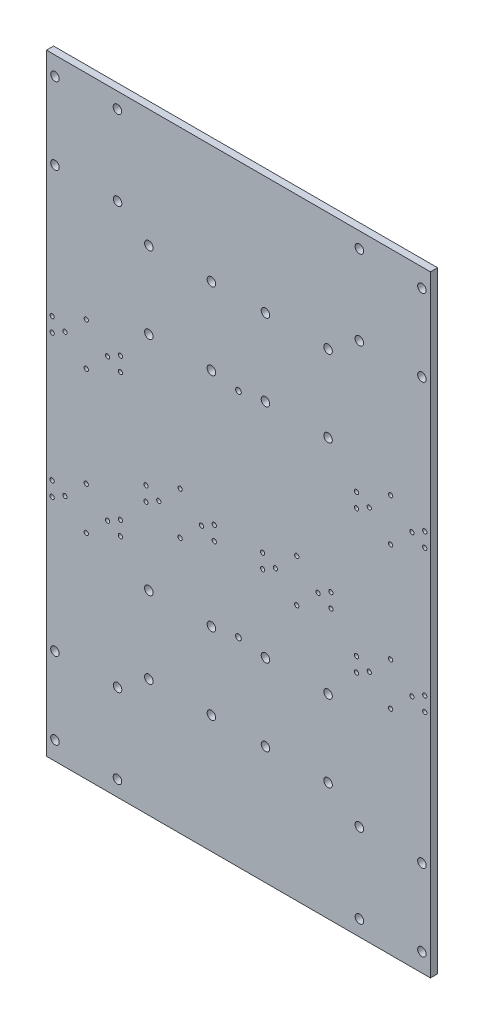
from build123d import *

# Parameters (mm, degrees)
SKETCH_1_W               = 270
SKETCH_1_H               = 430
SM_BASE_FLANGE_366_DEPTH = 5
SKETCH_9_R               = 2
CUT_EXTRUDE_4_DEPTH      = 10
SKETCH_10_R              = 1.5
CUT_EXTRUDE_5_DEPTH      = 10
SKETCH_11_R              = 1.5
CUT_EXTRUDE_6_DEPTH      = 10
MIRROR_4_COPY_1_SKETCH_R = 1.5
MIRROR_4_COPY_1_DEPTH    = 10
MIRROR_4_COPY_2_SKETCH_R = 1.5
MIRROR_4_COPY_2_DEPTH    = 10
SKETCH_12_R              = 3
CUT_EXTRUDE_7_DEPTH      = 10
MIRROR_6_COPY_1_SKETCH_R = 3
MIRROR_6_COPY_1_DEPTH    = 10
SKETCH_13_R              = 3
CUT_EXTRUDE_8_DEPTH      = 10
MIRROR_8_COPY_1_SKETCH_R = 3
MIRROR_8_COPY_1_DEPTH    = 10
SKETCH_14_R              = 1.5
CUT_EXTRUDE_9_DEPTH      = 10


# Sheet-metal steps are written as plain solids
with BuildPart() as part:
    # Sketch 1 → Sm Base Flange 366 (new body)
    with BuildSketch(Plane.XY):
        Rectangle(SKETCH_1_W, SKETCH_1_H)
    extrude(amount=-SM_BASE_FLANGE_366_DEPTH)

    # 草图9 → 切除-拉伸4 (cut)
    with BuildSketch(Plane.XY):
        with Locations((0, 75)):
            Circle(SKETCH_9_R)
        with Locations((0, -75)):
            Circle(SKETCH_9_R)
    extrude(amount=-CUT_EXTRUDE_4_DEPTH, mode=Mode.SUBTRACT)

    # 草图10 → 切除-拉伸5 (cut)
    with BuildSketch(Plane.XY):
        with Locations((-107, 65)):
            Circle(SKETCH_10_R)
        with Locations((-92, 50)):
            Circle(SKETCH_10_R)
        with Locations((-107, 35)):
            Circle(SKETCH_10_R)
        with Locations((-122, 50)):
            Circle(SKETCH_10_R)
    cut_extrude_5 = extrude(amount=-CUT_EXTRUDE_5_DEPTH, mode=Mode.SUBTRACT)

    # 草图11 → 切除-拉伸6 (cut)
    with BuildSketch(Plane(origin=(0, 0, -5), x_dir=(-1, 0, 0), z_dir=(0, 0, -1))):
        with Locations((131, 55)):
            Circle(SKETCH_11_R)
        with Locations((131, 45)):
            Circle(SKETCH_11_R)
        with Locations((83, 45)):
            Circle(SKETCH_11_R)
        with Locations((83, 55)):
            Circle(SKETCH_11_R)
    cut_extrude_6 = extrude(amount=-CUT_EXTRUDE_6_DEPTH, mode=Mode.SUBTRACT)

    # 镜向3: 切除-拉伸5, 切除-拉伸6 across plane
    add(cut_extrude_5.mirror(Plane(origin=(0, 0, 0), x_dir=(0, 0, 1), z_dir=(1, 0, 0))), mode=Mode.SUBTRACT)
    add(cut_extrude_6.mirror(Plane(origin=(0, 0, 0), x_dir=(0, 0, 1), z_dir=(1, 0, 0))), mode=Mode.SUBTRACT)

    # 镜向4: 切除-拉伸5, 切除-拉伸6 across plane
    add(cut_extrude_5.mirror(Plane.ZX), mode=Mode.SUBTRACT)
    add(cut_extrude_6.mirror(Plane.ZX), mode=Mode.SUBTRACT)

    # 镜向4 copy 1 sketch → 镜向4 copy 1 (cut)
    with BuildSketch(Plane(origin=(0, 0, 0), x_dir=(-1, 0, 0), z_dir=(0, 0, 1))):
        with Locations((-107, 65)):
            Circle(MIRROR_4_COPY_1_SKETCH_R)
        with Locations((-92, 50)):
            Circle(MIRROR_4_COPY_1_SKETCH_R)
        with Locations((-107, 35)):
            Circle(MIRROR_4_COPY_1_SKETCH_R)
        with Locations((-122, 50)):
            Circle(MIRROR_4_COPY_1_SKETCH_R)
    extrude(amount=-MIRROR_4_COPY_1_DEPTH, mode=Mode.SUBTRACT)

    # 镜向4 copy 2 sketch → 镜向4 copy 2 (cut)
    with BuildSketch(Plane(origin=(0, 0, -5), x_dir=(1, 0, 0), z_dir=(0, 0, -1))):
        with Locations((131, 55)):
            Circle(MIRROR_4_COPY_2_SKETCH_R)
        with Locations((131, 45)):
            Circle(MIRROR_4_COPY_2_SKETCH_R)
        with Locations((83, 45)):
            Circle(MIRROR_4_COPY_2_SKETCH_R)
        with Locations((83, 55)):
            Circle(MIRROR_4_COPY_2_SKETCH_R)
    extrude(amount=-MIRROR_4_COPY_2_DEPTH, mode=Mode.SUBTRACT)

    # 草图12 → 切除-拉伸7 (cut)
    with BuildSketch(Plane(origin=(0, 0, -5), x_dir=(-1, 0, 0), z_dir=(0, 0, -1))):
        with Locations((-129, 202)):
            Circle(SKETCH_12_R)
        with Locations((-129, 148)):
            Circle(SKETCH_12_R)
        with Locations((-85.045478048, 204)):
            Circle(SKETCH_12_R)
        with Locations((-85, 148)):
            Circle(SKETCH_12_R)
    cut_extrude_7 = extrude(amount=-CUT_EXTRUDE_7_DEPTH, mode=Mode.SUBTRACT)

    # 镜向5: 切除-拉伸7 across plane
    add(cut_extrude_7.mirror(Plane.ZX), mode=Mode.SUBTRACT)

    # 镜向6: 切除-拉伸7 across plane
    add(cut_extrude_7.mirror(Plane(origin=(0, 0, 0), x_dir=(0, 0, 1), z_dir=(1, 0, 0))), mode=Mode.SUBTRACT)

    # 镜向6 copy 1 sketch → 镜向6 copy 1 (cut)
    with BuildSketch(Plane(origin=(0, 0, -5), x_dir=(1, 0, 0), z_dir=(0, 0, -1))):
        with Locations((-129, 202)):
            Circle(MIRROR_6_COPY_1_SKETCH_R)
        with Locations((-129, 148)):
            Circle(MIRROR_6_COPY_1_SKETCH_R)
        with Locations((-85.045478048, 204)):
            Circle(MIRROR_6_COPY_1_SKETCH_R)
        with Locations((-85, 148)):
            Circle(MIRROR_6_COPY_1_SKETCH_R)
    extrude(amount=-MIRROR_6_COPY_1_DEPTH, mode=Mode.SUBTRACT)

    # 草图13 → 切除-拉伸8 (cut)
    with BuildSketch(Plane(origin=(0, 0, -5), x_dir=(-1, 0, 0), z_dir=(0, 0, -1))):
        with Locations((-63, -132)):
            Circle(SKETCH_13_R)
        with Locations((-63, -78)):
            Circle(SKETCH_13_R)
        with Locations((-19, -78)):
            Circle(SKETCH_13_R)
        with Locations((-19, -132)):
            Circle(SKETCH_13_R)
    cut_extrude_8 = extrude(amount=-CUT_EXTRUDE_8_DEPTH, mode=Mode.SUBTRACT)

    # 镜向7: 切除-拉伸8 across plane
    add(cut_extrude_8.mirror(Plane(origin=(0, 0, 0), x_dir=(0, 0, 1), z_dir=(1, 0, 0))), mode=Mode.SUBTRACT)

    # 镜向8: 切除-拉伸8 across plane
    add(cut_extrude_8.mirror(Plane.ZX), mode=Mode.SUBTRACT)

    # 镜向8 copy 1 sketch → 镜向8 copy 1 (cut)
    with BuildSketch(Plane(origin=(0, 0, -5), x_dir=(1, 0, 0), z_dir=(0, 0, -1))):
        with Locations((-63, -132)):
            Circle(MIRROR_8_COPY_1_SKETCH_R)
        with Locations((-63, -78)):
            Circle(MIRROR_8_COPY_1_SKETCH_R)
        with Locations((-19, -78)):
            Circle(MIRROR_8_COPY_1_SKETCH_R)
        with Locations((-19, -132)):
            Circle(MIRROR_8_COPY_1_SKETCH_R)
    extrude(amount=-MIRROR_8_COPY_1_DEPTH, mode=Mode.SUBTRACT)

    # 草图14 → 切除-拉伸9 (cut)
    with BuildSketch(Plane(origin=(0, 0, -5), x_dir=(-1, 0, 0), z_dir=(0, 0, -1))):
        with Locations((-41, -5)):
            Circle(SKETCH_14_R)
        with Locations((-26, -20)):
            Circle(SKETCH_14_R)
        with Locations((-41, -35)):
            Circle(SKETCH_14_R)
        with Locations((-56, -20)):
            Circle(SKETCH_14_R)
        with Locations((-65.004998612, -15)):
            Circle(SKETCH_14_R)
        with Locations((-65.004998612, -25)):
            Circle(SKETCH_14_R)
        with Locations((-16.995001388, -25)):
            Circle(SKETCH_14_R)
        with Locations((-16.995001388, -15)):
            Circle(SKETCH_14_R)
    cut_extrude_9 = extrude(amount=-CUT_EXTRUDE_9_DEPTH, mode=Mode.SUBTRACT)

    # 镜向9: 切除-拉伸9 across plane
    add(cut_extrude_9.mirror(Plane(origin=(0, 0, 0), x_dir=(0, 0, 1), z_dir=(1, 0, 0))), mode=Mode.SUBTRACT)


solid = part.part
